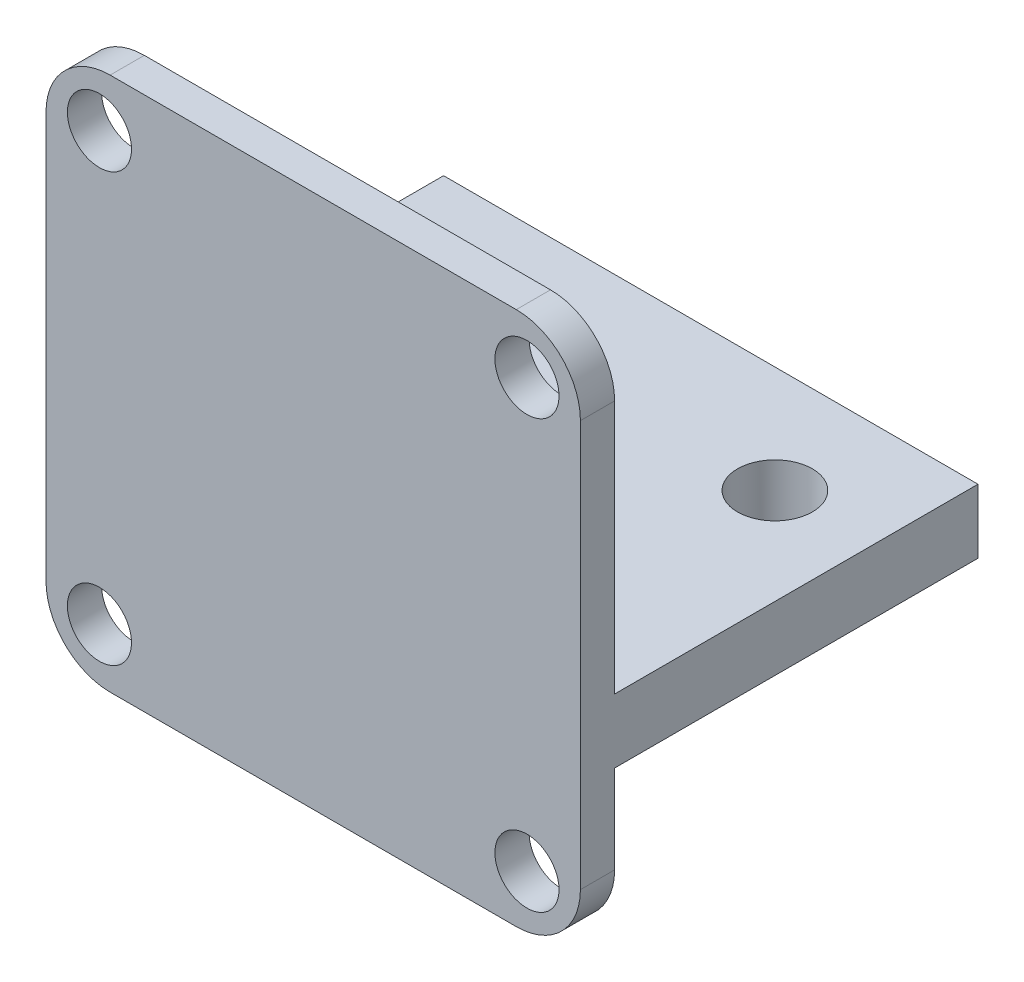
from build123d import *

# Parameters (mm, degrees)
SKETCH1_R           = 1.5
BOSS_EXTRUDE1_DEPTH = 1.6
SKETCH2_W           = 25
SKETCH2_H           = 3
BOSS_EXTRUDE2_DEPTH = 17
SKETCH3_R           = 1.75
CUT_EXTRUDE1_DEPTH  = 26.8169639


with BuildPart() as part:
    # Sketch1 → Boss-Extrude1 (new body)
    with BuildSketch(Plane.XY):
        with BuildLine():
            Line((-9.5, -12.5), (9.5, -12.5))
            ThreePointArc((9.5, -12.5), (11.621320344, -11.621320344), (12.5, -9.5))
            Line((12.5, -9.5), (12.5, 9.5))
            ThreePointArc((12.5, 9.5), (11.621320344, 11.621320344), (9.5, 12.5))
            Line((9.5, 12.5), (-9.5, 12.5))
            ThreePointArc((-9.5, 12.5), (-11.621320344, 11.621320344), (-12.5, 9.5))
            Line((-12.5, 9.5), (-12.5, -9.5))
            ThreePointArc((-12.5, -9.5), (-11.621320344, -11.621320344), (-9.5, -12.5))
        make_face()
        with Locations((-10, 10)):
            Circle(SKETCH1_R, mode=Mode.SUBTRACT)
        with Locations((10, 10)):
            Circle(SKETCH1_R, mode=Mode.SUBTRACT)
        with Locations((10, -10)):
            Circle(SKETCH1_R, mode=Mode.SUBTRACT)
        with Locations((-10, -10)):
            Circle(SKETCH1_R, mode=Mode.SUBTRACT)
    extrude(amount=BOSS_EXTRUDE1_DEPTH)

    # Sketch2 → Boss-Extrude2 (add)
    with BuildSketch(Plane(origin=(0, 0, 0), x_dir=(-1, 0, 0), z_dir=(0, 0, -1))):
        with Locations((0, -3.875)):
            Rectangle(SKETCH2_W, SKETCH2_H)
    extrude(amount=BOSS_EXTRUDE2_DEPTH)

    # Sketch3 → Cut-Extrude1 (cut, through all)
    with BuildSketch(Plane(origin=(0, -2.375, 0), x_dir=(1, 0, 0), z_dir=(0, 1, 0))):
        with Locations((-8, 12)):
            Circle(SKETCH3_R)
        with Locations((8, 12)):
            Circle(SKETCH3_R)
    extrude(amount=-CUT_EXTRUDE1_DEPTH, mode=Mode.SUBTRACT)


solid = part.part
